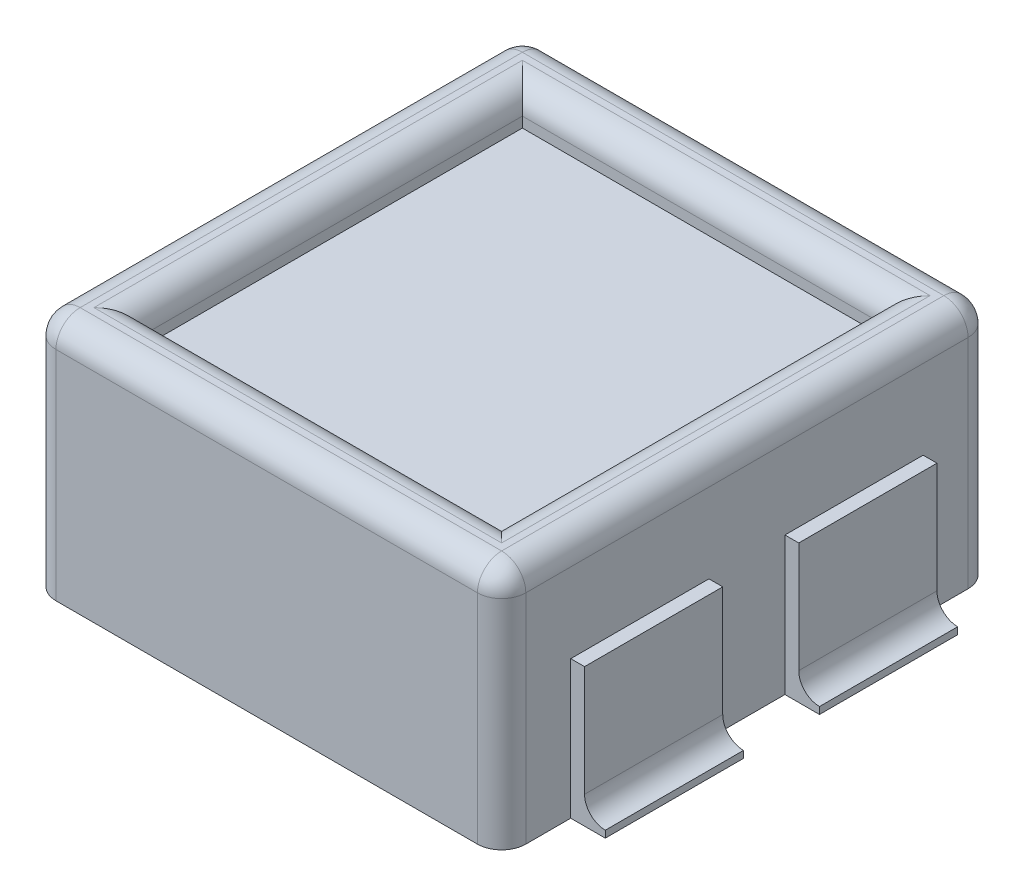
from build123d import *

# Parameters (mm, degrees)
SKETCH1_W            = 1.7272
SKETCH1_H            = 1.8034
BOSS_EXTRUDE1_DEPTH  = 0.889
SKETCH2_W            = 1.3208
SKETCH2_H            = 1.397
CUT_EXTRUDE1_DEPTH   = 0.127
FILLET1_R            = 0.0889
SKETCH3_W            = 0.508
SKETCH3_H            = 0.508
BOSS_EXTRUDE2_DEPTH  = 0.0508
SKETCH4_W            = 0.0762
SKETCH4_H            = 0.508
BOSS_EXTRUDE3_DEPTH  = 0.0254
FILLET2_R            = 0.0762
FILLET2_OF_MIRROR1_R = 0.0762


with BuildPart() as part:
    # Sketch1 → Boss-Extrude1 (new body)
    with BuildSketch(Plane(origin=(0, 0, 0), x_dir=(1, 0, 0), z_dir=(0, 1, 0))):
        Rectangle(SKETCH1_W, SKETCH1_H)
    extrude(amount=BOSS_EXTRUDE1_DEPTH)

    # Sketch2 → Cut-Extrude1 (cut)
    with BuildSketch(Plane(origin=(0, 0.889, 0), x_dir=(1, 0, 0), z_dir=(0, 1, 0))):
        Rectangle(SKETCH2_W, SKETCH2_H)
    extrude(amount=-CUT_EXTRUDE1_DEPTH, mode=Mode.SUBTRACT)

    # Fillet1
    fillet1_edges = [part.edges().sort_by_distance(p)[0] for p in [
        (-0.8636, 0.889, 0),
        (0, 0.889, 0.9017),
        (0.6604, 0.889, 0),
        (0, 0.889, -0.6985),
        (-0.6604, 0.889, 0),
        (0, 0.889, 0.6985),
        (0.8636, 0.889, 0),
        (0, 0.889, -0.9017),
        (0.8636, 0.4445, 0.9017),
        (-0.8636, 0.4445, 0.9017),
        (-0.8636, 0.4445, -0.9017),
        (0.8636, 0.4445, -0.9017),
    ]]
    fillet(fillet1_edges, radius=FILLET1_R)

    # Sketch3 → Boss-Extrude2 (add)
    with BuildSketch(Plane(origin=(0.8636, 0, 0), x_dir=(0, 0, -1), z_dir=(1, 0, 0))):
        with Locations((-0.3937, 0.254)):
            Rectangle(SKETCH3_W, SKETCH3_H)
        with Locations((0.3937, 0.254)):
            Rectangle(SKETCH3_W, SKETCH3_H)
    boss_extrude2 = extrude(amount=BOSS_EXTRUDE2_DEPTH)

    # Sketch4 → Boss-Extrude3 (add)
    with BuildSketch(Plane(origin=(0, 0, 0), x_dir=(1, 0, 0), z_dir=(0, 1, 0))):
        with Locations((0.9525, -0.3937)):
            Rectangle(SKETCH4_W, SKETCH4_H)
        with Locations((0.9525, 0.3937)):
            Rectangle(SKETCH4_W, SKETCH4_H)
    boss_extrude3 = extrude(amount=BOSS_EXTRUDE3_DEPTH)

    # Fillet2
    fillet2_edges = [part.edges().sort_by_distance(p)[0] for p in [
        (0.9144, 0.0254, 0.3937),
        (0.9144, 0.0254, -0.3937),
    ]]
    fillet(fillet2_edges, radius=FILLET2_R - 0.0001)  # a hair under: the kernel refuses the full size

    # Mirror1: Boss-Extrude2, Boss-Extrude3 across plane
    add(boss_extrude2.mirror(Plane(origin=(0, 0, 0), x_dir=(0, 0, 1), z_dir=(1, 0, 0))))
    add(boss_extrude3.mirror(Plane(origin=(0, 0, 0), x_dir=(0, 0, 1), z_dir=(1, 0, 0))))

    # Fillet2 of Mirror1
    fillet2_of_mirror1_edges = [part.edges().sort_by_distance(p)[0] for p in [
        (-0.9144, 0.0254, 0.3937),
        (-0.9144, 0.0254, -0.3937),
    ]]
    fillet(fillet2_of_mirror1_edges, radius=FILLET2_OF_MIRROR1_R - 0.0001)  # a hair under: the kernel refuses the full size


solid = part.part
